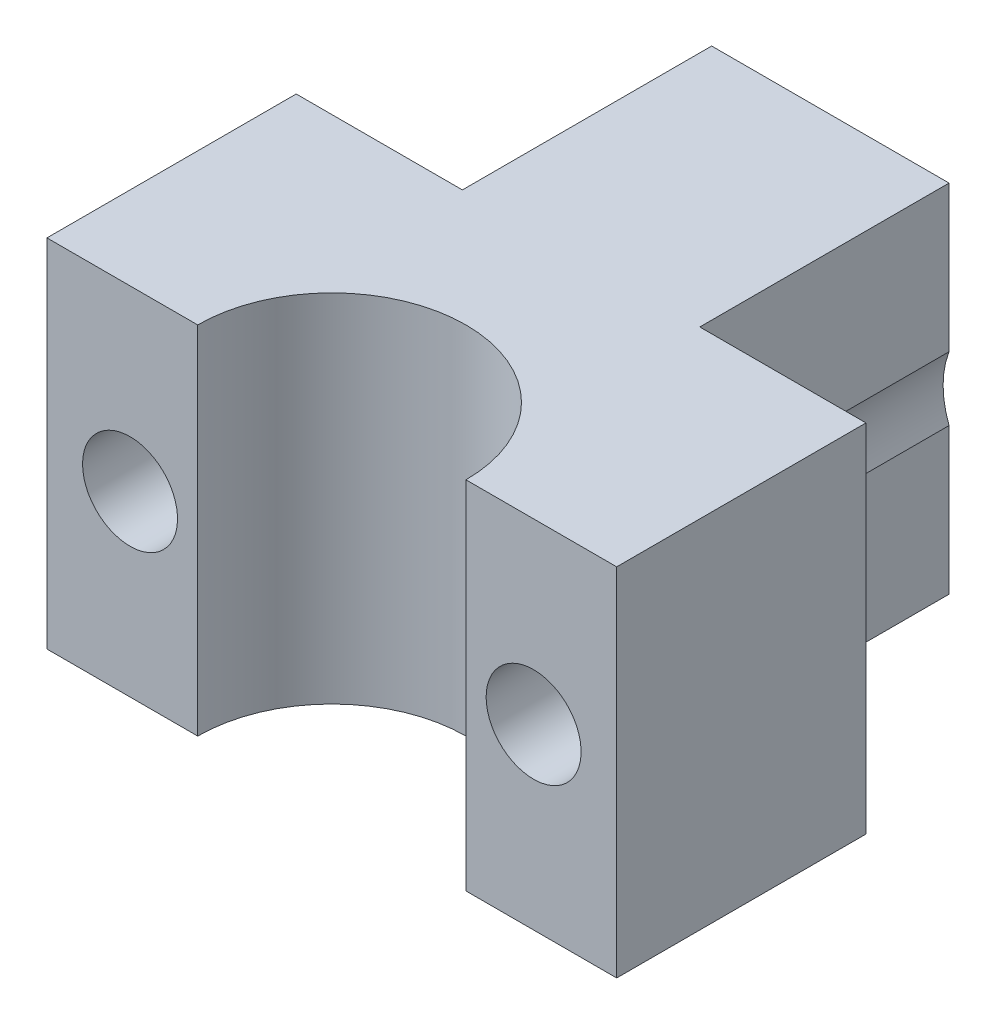
from build123d import *

# Parameters (mm, degrees)
SKETCH_1_W          = 48
SKETCH_1_H          = 20
EXTRUDE_1_DEPTH     = 30
SKETCH_2_W          = 14
SKETCH_2_H          = 30
CUT_EXTRUDE_1_DEPTH = 7
SKETCH_7_W          = 22
SKETCH_7_H          = 30
EXTRUDE_2_DEPTH     = 48
SKETCH_8_W          = 21
SKETCH_8_H          = 30
CUT_EXTRUDE_2_DEPTH = 14
SKETCH_9_W          = 21
SKETCH_9_H          = 30
CUT_EXTRUDE_3_DEPTH = 14
SKETCH_11_W         = 10.2
SKETCH_11_H         = 20.2
CUT_EXTRUDE_4_DEPTH = 56.497747702
SKETCH_13_R         = 4
CUT_EXTRUDE_5_DEPTH = 44.783558558
SKETCH_14_R         = 4
CUT_EXTRUDE_6_DEPTH = 44.783558558
FILLET_1_R          = 7
SKETCH1_W           = 10.2
SKETCH1_H           = 20.2
BOSS_EXTRUDE1_DEPTH = 4
SKETCH_20_R         = 7.5
CUT_EXTRUDE_8_DEPTH = 44.783558558
SKETCH2_R           = 11.3
CUT_EXTRUDE1_DEPTH  = 51


with BuildPart() as part:
    # Эскиз1 → Бобышка-Вытянуть1 (new body)
    with BuildSketch(Plane(origin=(0, 0, 0), x_dir=(1, 0, 0), z_dir=(0, 1, 0))):
        Rectangle(SKETCH_1_W, SKETCH_1_H)
    extrude(amount=EXTRUDE_1_DEPTH)

    # Эскиз2 → Вырез-Вытянуть1 (cut)
    with BuildSketch(Plane.XY.offset(10)):
        with Locations((0, 15)):
            Rectangle(SKETCH_2_W, SKETCH_2_H)
    extrude(amount=-CUT_EXTRUDE_1_DEPTH, mode=Mode.SUBTRACT)

    # Эскиз7 → Бобышка-Вытянуть2 (add)
    with BuildSketch(Plane(origin=(24, 0, 0), x_dir=(0, 0, -1), z_dir=(1, 0, 0))):
        with Locations((21, 15)):
            Rectangle(SKETCH_7_W, SKETCH_7_H)
    extrude(amount=-EXTRUDE_2_DEPTH)

    # Эскиз8 → Вырез-Вытянуть2 (cut)
    with BuildSketch(Plane(origin=(24, 0, 0), x_dir=(0, 0, -1), z_dir=(1, 0, 0))):
        with Locations((21.5, 15)):
            Rectangle(SKETCH_8_W, SKETCH_8_H)
    extrude(amount=-CUT_EXTRUDE_2_DEPTH, mode=Mode.SUBTRACT)

    # Эскиз9 → Вырез-Вытянуть3 (cut)
    with BuildSketch(Plane.ZY.offset(24)):
        with Locations((-21.5, 15)):
            Rectangle(SKETCH_9_W, SKETCH_9_H)
    extrude(amount=-CUT_EXTRUDE_3_DEPTH, mode=Mode.SUBTRACT)

    # Эскиз11 → Вырез-Вытянуть4 (cut, through all)
    with BuildSketch(Plane.ZY.offset(10)):
        with Locations((-21.5, 15)):
            Rectangle(SKETCH_11_W, SKETCH_11_H)
    extrude(amount=-CUT_EXTRUDE_4_DEPTH, mode=Mode.SUBTRACT)

    # Эскиз13 → Вырез-Вытянуть5 (cut, through all)
    with BuildSketch(Plane(origin=(0, 0, -11), x_dir=(-1, 0, 0), z_dir=(0, 0, -1))):
        with Locations((17, 15)):
            Circle(SKETCH_13_R)
    extrude(amount=-CUT_EXTRUDE_5_DEPTH, mode=Mode.SUBTRACT)

    # Эскиз14 → Вырез-Вытянуть6 (cut, through all)
    with BuildSketch(Plane(origin=(0, 0, -11), x_dir=(-1, 0, 0), z_dir=(0, 0, -1))):
        with Locations((-17, 15)):
            Circle(SKETCH_14_R)
    extrude(amount=-CUT_EXTRUDE_6_DEPTH, mode=Mode.SUBTRACT)

    # Скругление1
    fillet_1_edges = [part.edges().sort_by_distance(p)[0] for p in [
        (-7, 15, 3),
        (7, 15, 3),
    ]]
    fillet(fillet_1_edges, radius=FILLET_1_R - 0.0001)  # a hair under: the kernel refuses the full size

    # Sketch1 → Boss-Extrude1 (add)
    with BuildSketch(Plane(origin=(10, 0, 0), x_dir=(0, 0, -1), z_dir=(1, 0, 0))):
        with Locations((21.5, 15)):
            Rectangle(SKETCH1_W, SKETCH1_H)
    extrude(amount=-BOSS_EXTRUDE1_DEPTH)

    # Эскиз20 → Вырез-Вытянуть8 (cut, through all)
    with BuildSketch(Plane(origin=(0, 0, -11), x_dir=(-1, 0, 0), z_dir=(0, 0, -1))):
        with Locations((-17, 15)):
            Circle(SKETCH_20_R)
        with Locations((17, 15)):
            Circle(SKETCH_20_R)
    extrude(amount=CUT_EXTRUDE_8_DEPTH, mode=Mode.SUBTRACT)

    # Sketch2 → Cut-Extrude1 (cut, through all)
    with BuildSketch(Plane(origin=(0, 30, 0), x_dir=(1, 0, 0), z_dir=(0, 1, 0))):
        with Locations((0, -10)):
            Circle(SKETCH2_R)
    extrude(amount=-CUT_EXTRUDE1_DEPTH, mode=Mode.SUBTRACT)


solid = part.part
